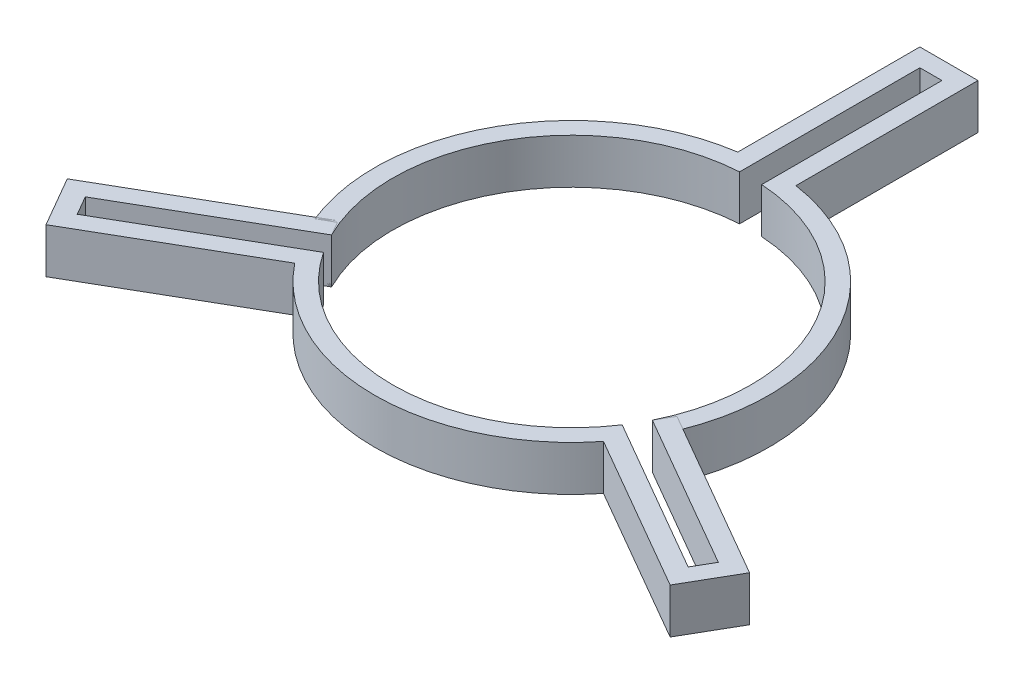
from build123d import *

# Parameters (mm, degrees)
SKETCH1_R           = 43.75
SKETCH1_R_2         = 39.75
BOSS_EXTRUDE1_DEPTH = 10
CUT_EXTRUDE1_DEPTH  = 63.674755684
BOSS_EXTRUDE2_DEPTH = 10
CIRPATTERN1_DEPTH   = 10
CIRPATTERN1_2_DEPTH = 10


# Read off the part's stored shape, not the designer's step: CirPattern1
with BuildPart() as part:
    # Sketch1 → Boss-Extrude1 (new body)
    with BuildSketch(Plane(origin=(0, 0, 0), x_dir=(1, 0, 0), z_dir=(0, 1, 0))):
        with Locations(Location((0, 0, 0), (0, 0, 270))):
            Circle(SKETCH1_R)
        with Locations(Location((0, 0, 0), (0, 0, 270))):
            Circle(SKETCH1_R_2, mode=Mode.SUBTRACT)
    extrude(amount=BOSS_EXTRUDE1_DEPTH)

    # Sketch2 → Cut-Extrude1 (cut, through all)
    with BuildSketch(Plane(origin=(0, 10, 0), x_dir=(1, 0, 0), z_dir=(0, 1, 0))):
        Polygon((0, 37.83827082), (-2.45, 37.83827082), (-2.45, 50.118406455), (1.287432584, 50.118406455), (2.45, 50.118406455), (2.45, 37.83827082), align=None)
    extrude(amount=-CUT_EXTRUDE1_DEPTH, mode=Mode.SUBTRACT)

    # Sketch3 → Boss-Extrude2 (add, through all)
    with BuildSketch(Plane(origin=(0, 10, 0), x_dir=(1, 0, 0), z_dir=(0, 1, 0))):
        Polygon((-2.45, 39.674425012), (-2.45, 79.674425012), (2.45, 79.674425012), (2.45, 39.674425012), (6.45, 39.674425012), (6.45, 83.674425012), (-6.45, 83.674425012), (-6.45, 39.674425012), align=None)
    extrude(amount=-BOSS_EXTRUDE2_DEPTH)

    # CirPattern1 outline → CirPattern1 (cut)
    with BuildSketch(Plane(origin=(0, 0, 0), x_dir=(1, 0, 0), z_dir=(0, 1, 0))):
        with BuildLine():
            ThreePointArc((-39.054155423, -19.718910827), (0, -43.75), (39.054155423, -19.718910827))
            Line((39.054155423, -19.718910827), (35.584059941, -17.715450267))
            ThreePointArc((35.584059941, -17.715450267), (0, -39.75), (-35.584059941, -17.715450267))
            Line((-35.584059941, -17.715450267), (-39.054155423, -19.718910827))
        make_face()
    extrude(amount=CIRPATTERN1_DEPTH, mode=Mode.SUBTRACT)


with BuildPart() as body_2:
    # CirPattern1 2 outline → CirPattern1 2 (new body)
    with BuildSketch(Plane(origin=(0, 0, 0), x_dir=(1, 0, 0), z_dir=(0, 1, 0))):
        with BuildLine():
            Line((67.775076092, -41.958974745), (33.134059941, -21.958974745))
            ThreePointArc((33.134059941, -21.958974745), (0, -39.75), (-33.134059941, -21.958974745))
            Line((-33.134059941, -21.958974745), (-67.775076092, -41.958974745))
            Line((-67.775076092, -41.958974745), (-70.225076092, -37.715450267))
            Line((-70.225076092, -37.715450267), (-35.584059941, -17.715450267))
            Line((-35.584059941, -17.715450267), (-37.584059941, -14.251348651))
            Line((-37.584059941, -14.251348651), (-75.689177707, -36.251348651))
            Line((-75.689177707, -36.251348651), (-69.239177707, -47.42307636))
            Line((-69.239177707, -47.42307636), (-34.249591392, -27.221829282))
            ThreePointArc((-34.249591392, -27.221829282), (0, -43.75), (34.249591392, -27.221829282))
            Line((34.249591392, -27.221829282), (69.239177707, -47.42307636))
            Line((69.239177707, -47.42307636), (75.689177707, -36.251348651))
            Line((75.689177707, -36.251348651), (37.584059941, -14.251348651))
            Line((37.584059941, -14.251348651), (35.584059941, -17.715450267))
            Line((35.584059941, -17.715450267), (70.225076092, -37.715450267))
            Line((70.225076092, -37.715450267), (67.775076092, -41.958974745))
        make_face()
    extrude(amount=CIRPATTERN1_2_DEPTH)


solid = Compound([part.part, body_2.part])
